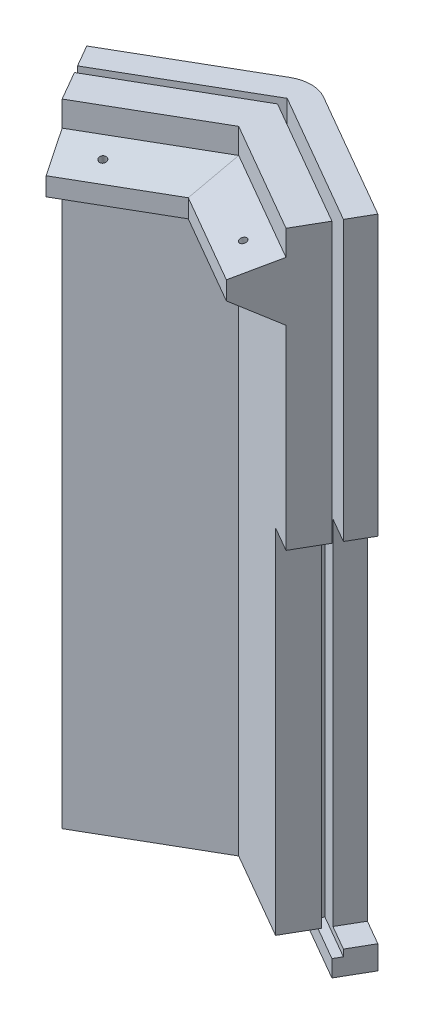
from build123d import *

# Parameters (mm, degrees)
BOSS_EXTRUDE1_DEPTH = 390
CUT_EXTRUDE2_DEPTH  = 14
CUT_EXTRUDE3_DEPTH  = 50
BOSS_EXTRUDE2_DEPTH = 10
BOSS_EXTRUDE3_REACH = 473.852
BOSS_EXTRUDE4_REACH = 479.913
SKETCH22_R          = 2.1
CUT_EXTRUDE4_DEPTH  = 15
SKETCH23_R          = 3.1
CUT_EXTRUDE5_DEPTH  = 60
SKETCH24_W          = 17
SKETCH24_H          = 210
CUT_EXTRUDE6_DEPTH  = 414.617211129


with BuildPart() as part:
    # Sketch1 → Boss-Extrude1 (new body)
    with BuildSketch(Plane(origin=(0, 0, 0), x_dir=(1, 0, 0), z_dir=(0, 1, 0))):
        with BuildLine():
            Line((-10, -5.773502692), (-86.602540378, -50))
            Line((-86.602540378, -50), (-79.102540378, -62.990381057))
            Line((-79.102540378, -62.990381057), (-53.121778265, -47.990381057))
            Line((-53.121778265, -47.990381057), (-50.621778265, -52.320508076))
            Line((-50.621778265, -52.320508076), (-76.602540378, -67.320508076))
            Line((-76.602540378, -67.320508076), (-66.602540378, -84.641016151))
            Line((-66.602540378, -84.641016151), (0, -46.188021535))
            Line((0, -46.188021535), (66.602540378, -84.641016151))
            Line((66.602540378, -84.641016151), (76.602540378, -67.320508076))
            Line((76.602540378, -67.320508076), (50.621778265, -52.320508076))
            Line((50.621778265, -52.320508076), (53.121778265, -47.990381057))
            Line((53.121778265, -47.990381057), (79.102540378, -62.990381057))
            Line((79.102540378, -62.990381057), (86.602540378, -50))
            Line((86.602540378, -50), (10, -5.773502692))
            ThreePointArc((10, -5.773502692), (0, -3.094010768), (-10, -5.773502692))
        make_face()
    extrude(amount=BOSS_EXTRUDE1_DEPTH)

    # Sketch18 → Cut-Extrude2 (cut)
    with BuildSketch(Plane.XZ):
        Polygon((-76.602540378, 67.320508076), (0, 23.094010768), (76.602540378, 67.320508076), (66.602540378, 84.641016151), (0, 46.188021535), (-66.602540378, 84.641016151), align=None)
    extrude(amount=-CUT_EXTRUDE2_DEPTH, mode=Mode.SUBTRACT)

    # Sketch19 → Cut-Extrude3 (cut)
    with BuildSketch(Plane(origin=(0, 390, 0), x_dir=(1, 0, 0), z_dir=(0, 1, 0))):
        Polygon((76.602540378, -67.320508076), (0, -23.094010768), (-76.602540378, -67.320508076), (-79.102540378, -62.990381057), (0, -17.320508076), (79.102540378, -62.990381057), align=None)
    extrude(amount=-CUT_EXTRUDE3_DEPTH, mode=Mode.SUBTRACT)

    # Sketch20 → Boss-Extrude2 (add)
    with BuildSketch(Plane.XZ):
        Polygon((76.602540378, 67.320508076), (50.621778265, 52.320508076), (53.121778265, 47.990381057), (79.102540378, 62.990381057), align=None)
        Polygon((-50.621778265, 52.320508076), (-76.602540378, 67.320508076), (-79.102540378, 62.990381057), (-53.121778265, 47.990381057), align=None)
    extrude(amount=-BOSS_EXTRUDE2_DEPTH)

    # Boss-Extrude3: up to this plane
    boss_extrude3_end = Plane(origin=(-86.602540378, 390, 50), z_dir=(0.8660254037844359, 0, -0.5000000000000048))
    # Sketch21 → Boss-Extrude3 (add, up to the surface)
    with BuildSketch(Plane(origin=(0, 0, 0), x_dir=(0, 0, -1), z_dir=(1, 0, 0)), mode=Mode.PRIVATE) as boss_extrude3_sk1:
        Polygon((-46.188021535, 375), (-76.188021535, 368.206188758), (-76.188021535, 357.320508076), (-46.188021535, 340), align=None)
    boss_extrude3_tool1 = split(extrude(boss_extrude3_sk1.sketch, amount=BOSS_EXTRUDE3_REACH, dir=(-0.866025403784, 0, 0.5), mode=Mode.PRIVATE), bisect_by=boss_extrude3_end, keep=Keep.BOTH, mode=Mode.PRIVATE)
    add(boss_extrude3_tool1.solids().sort_by_distance((0, 359.670666, 58.56037))[0])

    # Boss-Extrude4: up to this plane
    boss_extrude4_end = Plane(origin=(76.602540378, 390, 67.320508076), z_dir=(-0.8660254037844398, 0, -0.49999999999999795))
    # Sketch21<2> → Boss-Extrude4 (add, up to the surface)
    with BuildSketch(Plane(origin=(0, 0, 0), x_dir=(0, 0, -1), z_dir=(1, 0, 0)), mode=Mode.PRIVATE) as boss_extrude4_sk1:
        Polygon((-46.188021535, 375), (-76.188021535, 368.206188758), (-76.188021535, 357.320508076), (-46.188021535, 340), align=None)
    boss_extrude4_tool1 = split(extrude(boss_extrude4_sk1.sketch, amount=BOSS_EXTRUDE4_REACH, dir=(0.866025403784, 0, 0.5), mode=Mode.PRIVATE), bisect_by=boss_extrude4_end, keep=Keep.BOTH, mode=Mode.PRIVATE)
    add(boss_extrude4_tool1.solids().sort_by_distance((0, 359.670666, 58.56037))[0])

    # Sketch22 → Cut-Extrude4 (cut)
    with BuildSketch(Plane(origin=(47.172106066, 360.789319124, 81.704484407), x_dir=(0.9919674102096397, -0.12336978823439819, -0.027938368473838713), z_dir=(0.12649370372465277, 0.9674695714450555, 0.21909352168866236))):
        with Locations((-89.639756751, -1.109544744)):
            Circle(SKETCH22_R)
    cut_extrude4 = extrude(amount=-CUT_EXTRUDE4_DEPTH, mode=Mode.SUBTRACT)

    # Mirror1: Cut-Extrude4 across plane
    add(cut_extrude4.mirror(Plane(origin=(0, 0, 0), x_dir=(0, 0, 1), z_dir=(1, 0, 0))), mode=Mode.SUBTRACT)

    # Sketch23 → Cut-Extrude5 (cut)
    with BuildSketch(Plane.XZ.offset(-14)):
        with Locations((-25.980762114, 49.641016151)):
            Circle(SKETCH23_R)
        with Locations((-51.961524227, 64.641016151)):
            Circle(SKETCH23_R)
    cut_extrude5 = extrude(amount=-CUT_EXTRUDE5_DEPTH, mode=Mode.SUBTRACT)

    # Mirror2: Cut-Extrude5 across plane
    add(cut_extrude5.mirror(Plane(origin=(0, 0, 0), x_dir=(0, 0, 1), z_dir=(1, 0, 0))), mode=Mode.SUBTRACT)

    # Sketch24 → Cut-Extrude6 (cut, through all)
    with BuildSketch(Plane(origin=(0, 0, 0), x_dir=(-0.8660254037844417, 0, -0.4999999999999947), z_dir=(0.4999999999999947, 0, -0.8660254037844417))):
        with Locations((-91.5, 119)):
            Rectangle(SKETCH24_W, SKETCH24_H)
    extrude(amount=-CUT_EXTRUDE6_DEPTH, mode=Mode.SUBTRACT)


solid = part.part
